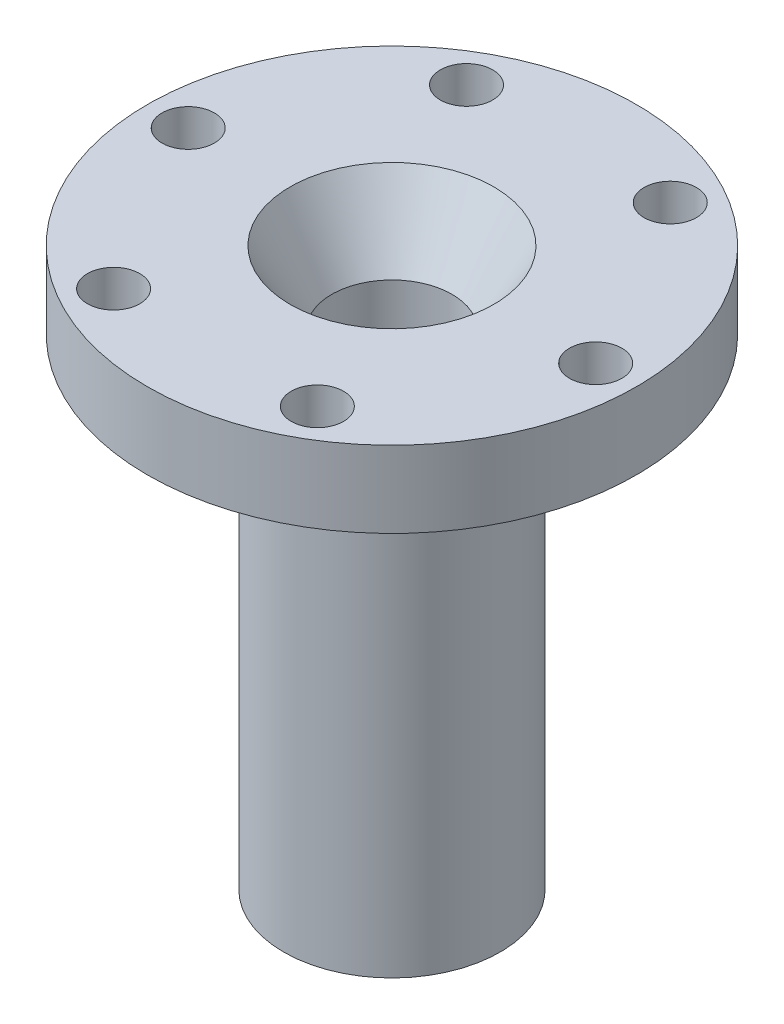
from build123d import *

# Parameters (mm, degrees)
F_1_4_CLEARANCE_HOLE1_D = 6.5278
CIRPATTERN1_COUNT       = 6
CHAMFER1_SIZE           = 2.032
CHAMFER1_SIZE2          = 0.820981291
FILLET1_R               = 0.79375
CHAMFER2_SIZE           = 3.175


with BuildPart() as part:
    # Sketch1 → Revolve1 (revolve)
    with BuildSketch(Plane.XY):
        Polygon((7.5, -69.525), (7.5, -9.006664199), (12.7, 0), (30.48, 0), (30.48, -9.525), (13.5, -9.525), (13.5, -69.525), align=None)
    revolve(axis=Axis((0, 0, 0), (0, -1, 0)))

    # 1/4 Clearance Hole1 (through all)
    with Locations(Plane(origin=(0, 0, 0), x_dir=(1, 0, 0), z_dir=(0, 1, 0))):
        with Locations((25.4, 0)):
            f_1_4_clearance_hole1 = Hole(F_1_4_CLEARANCE_HOLE1_D / 2)

    # CirPattern1: 1/4 Clearance Hole1 ×6 about axis
    cirpattern1_axis = Axis((0, 0, 0), (0, 1, 0))
    for i in range(1, CIRPATTERN1_COUNT):
        add(f_1_4_clearance_hole1.rotate(cirpattern1_axis, i * 360 / CIRPATTERN1_COUNT), mode=Mode.SUBTRACT)

    # Chamfer1
    chamfer1_edges = [part.edges().sort_by_distance(p)[0] for p in [
        (-7.5, -69.525, 0),
    ]]
    chamfer1_side = [part.faces().sort_by_distance(p)[0] for p in [
        (-13.118162338, -69.525, 0),
    ]]
    chamfer(chamfer1_edges, length=CHAMFER1_SIZE, length2=CHAMFER1_SIZE2, reference=chamfer1_side[0])

    # Fillet1
    fillet1_edges = [part.edges().sort_by_distance(p)[0] for p in [
        (-7.5, -68.704018709, 0),
    ]]
    fillet(fillet1_edges, radius=FILLET1_R)

    # Chamfer2
    chamfer2_edges = [part.edges().sort_by_distance(p)[0] for p in [
        (-13.5, -9.525, 0),
    ]]
    chamfer(chamfer2_edges, length=CHAMFER2_SIZE)


solid = part.part
